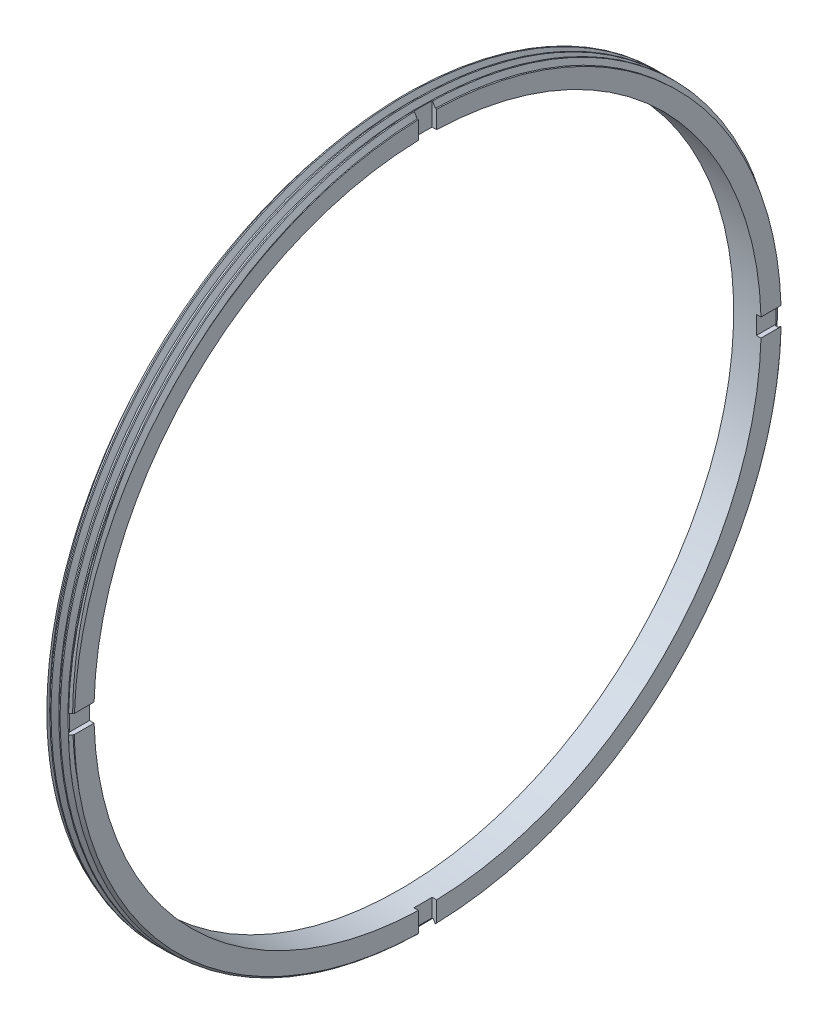
from build123d import *

# Parameters (mm, degrees)
SKICA1_W                 = 3
SKICA1_H                 = 2.5
ZKOSEN_1_SIZE            = 0.3
Z_VIT1_PITCH             = 1
SKICA5_W                 = 1
SKICA5_H                 = 2
ODEBRAT_VYSUNUT_M1_DEPTH = 56.235858065
KRUHOV_POLE1_COUNT       = 2
KRUHOV_POLE1_ANGLE       = 90


with BuildPart() as part:
    # Skica1 → Rotovat1 (revolve)
    with BuildSketch(Plane.XY, mode=Mode.PRIVATE) as rotovat1_sk:
        with Locations((1.5, 37.75)):
            Rectangle(SKICA1_W, SKICA1_H)
    revolve(rotovat1_sk.sketch.rotate(Axis((0, 0, 0), (1, 0, 0)), 90), axis=Axis((0, 0, 0), (1, 0, 0)))

    # Zkosení1
    zkosen_1_edges = [part.edges().sort_by_distance(p)[0] for p in [
        (3, 0, -39),
        (0, 0, -39),
    ]]
    chamfer(zkosen_1_edges, length=ZKOSEN_1_SIZE)

    # Závit1: arcs per turn and ends read off the stored shape
    # Závit1: the profile of Profil závitu1 profile screwed along a right-hand helix through 4.4 turns, 8 arcs to a turn; built about Z, then put on its axis
    z_vit1_z = Axis((0, 0, 0), (0, 0, 1))
    z_vit1_corners = [(39.0003, 0, -0.000173205), (39.0003, 0, 0.875173202), (38.458734125, 0, 0.562499999), (38.458734125, 0, 0.312499999)]
    with BuildLine(mode=Mode.PRIVATE) as z_vit1_profile:
        Line(z_vit1_corners[0], z_vit1_corners[1])
        Line(z_vit1_corners[1], z_vit1_corners[2])
        Line(z_vit1_corners[2], z_vit1_corners[3])
        Line(z_vit1_corners[3], z_vit1_corners[0])
    z_vit1_cap = Face(z_vit1_profile.wire())
    z_vit1_turn_angles = [0, 22.5, 45, 67.5, 90, 112.5, 135, 157.5, 180, 202.5, 225, 247.5, 270, 292.5, 315, 337.5, 360]
    z_vit1_turn_weights = [1, 0.9238795325112867, 1, 0.9238795325112867, 1, 0.9238795325112867, 1, 0.9238795325112867, 1, 0.9238795325112867, 1, 0.9238795325112867, 1, 0.9238795325112867, 1, 0.9238795325112867, 1]
    z_vit1_turn_rails = [Edge.make_bspline([Vector(p[0], p[1], 0).rotate(z_vit1_z, z_vit1_turn_angles[k]) / z_vit1_turn_weights[k] + Vector(0, 0, p[2] + Z_VIT1_PITCH * z_vit1_turn_angles[k] / 360) for k in range(17)], [0, 0, 0, 1, 1, 2, 2, 3, 3, 4, 4, 5, 5, 6, 6, 7, 7, 8, 8, 8], 2, z_vit1_turn_weights) for p in z_vit1_corners]
    z_vit1_turn_sides = [Face.make_surface_from_curves(z_vit1_turn_rails[p[0]], z_vit1_turn_rails[p[1]]) for p in [(0, 1), (1, 2), (2, 3), (3, 0)]]
    z_vit1_last_angles = [1440, 1462.5, 1485, 1507.5, 1530, 1552.5, 1575, 1579.5, 1584]
    z_vit1_last_weights = [1, 0.9238795325112867, 1, 0.9238795325112867, 1, 0.9238795325112867, 1, 0.996917333733128, 1]
    z_vit1_last_rails = [Edge.make_bspline([Vector(p[0], p[1], 0).rotate(z_vit1_z, z_vit1_last_angles[k]) / z_vit1_last_weights[k] + Vector(0, 0, p[2] + Z_VIT1_PITCH * z_vit1_last_angles[k] / 360) for k in range(9)], [0, 0, 0, 1, 1, 2, 2, 3, 3, 4, 4, 4], 2, z_vit1_last_weights) for p in z_vit1_corners]
    z_vit1_last_sides = [Face.make_surface_from_curves(z_vit1_last_rails[p[0]], z_vit1_last_rails[p[1]]) for p in [(0, 1), (1, 2), (2, 3), (3, 0)]]
    z_vit1 = Plane(origin=(-0.7, 0, 0), x_dir=(0, 0, -1), z_dir=(1, 0, 0)) * Solid(Shell([*[p.moved(Location((0, 0, Z_VIT1_PITCH * i))) for i in range(4) for p in z_vit1_turn_sides], *z_vit1_last_sides, z_vit1_cap, z_vit1_cap.rotate(z_vit1_z, 1584).moved(Location((0, 0, Z_VIT1_PITCH * 1584 / 360)))]))
    add(z_vit1, mode=Mode.SUBTRACT)

    # Skica5 → Odebrat vysunutím1 (cut, symmetric)
    with BuildSketch(Plane(origin=(0, 0, 0), x_dir=(1, 0, 0), z_dir=(0, 1, 0))):
        with Locations((3, 0)):
            Rectangle(SKICA5_W, SKICA5_H)
    odebrat_vysunut_m1 = extrude(amount=ODEBRAT_VYSUNUT_M1_DEPTH, both=True, mode=Mode.SUBTRACT)

    # Kruhové pole1: Odebrat vysunutím1 ×2 about axis
    kruhov_pole1_axis = Axis((0, 0, 0), (1, 0, 0))
    for i in range(1, KRUHOV_POLE1_COUNT):
        add(odebrat_vysunut_m1.rotate(kruhov_pole1_axis, i * KRUHOV_POLE1_ANGLE / (KRUHOV_POLE1_COUNT - 1)), mode=Mode.SUBTRACT)


solid = part.part
